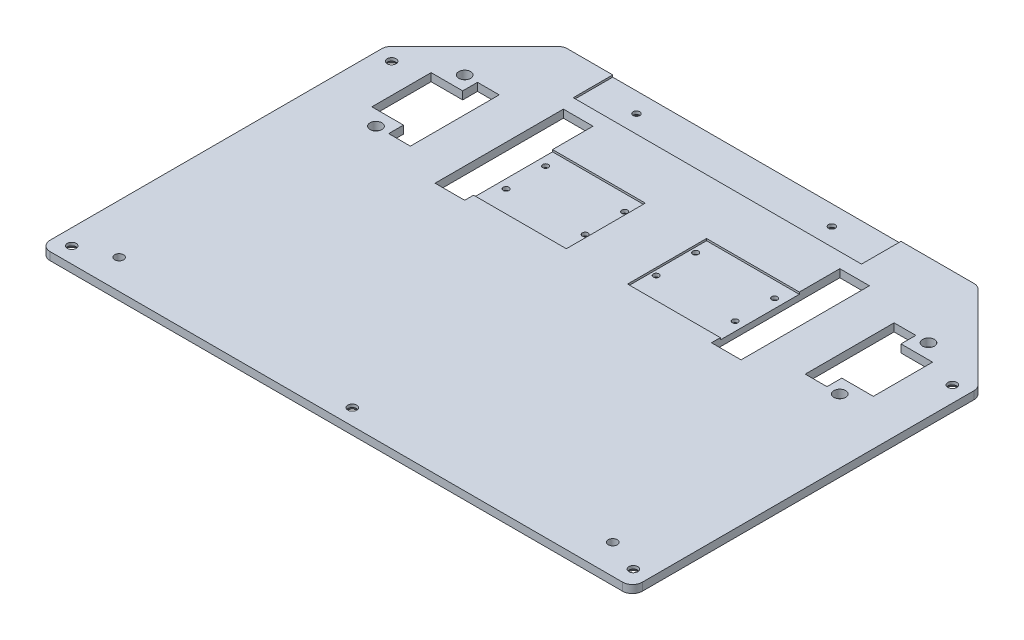
from build123d import *

# Parameters (mm, degrees)
MAIN_EXTRUSION_DEPTH                             = 4
CORNER_LEAVE_R                                   = 5
ESQUISSE2_R                                      = 3
ESQUISSE2_W                                      = 15
ESQUISSE2_H                                      = 65
ENL_V_MAT_EXTRU_1_DEPTH                          = 267.30058205
D_GAGEMENT_M41_D                                 = 4.5
ESQUISSE23_W                                     = 47
ESQUISSE23_H                                     = 40
ENL_V_MAT_EXTRU_2_DEPTH                          = 1
ESQUISSE24_R                                     = 1
ENL_V_MAT_EXTRU_3_DEPTH                          = 267.287438682
FRAISAGE_POUR_VIS_T_TE_FRAIS_E_M2_51_D           = 2.9
FRAISAGE_POUR_VIS_T_TE_FRAIS_E_M2_51_CSINK_D     = 5.5
FRAISAGE_POUR_VIS_T_TE_FRAIS_E_M2_51_CSINK_ANGLE = 90
FRAISAGE_POUR_VIS_T_TE_FRAIS_E_M41_AT_COUNT      = 2
FRAISAGE_POUR_VIS_T_TE_FRAIS_E_M41_AT_PITCH      = 142.035307944
FRAISAGE_POUR_VIS_T_TE_FRAIS_E_M41_2_COUNT       = 2
FRAISAGE_POUR_VIS_T_TE_FRAIS_E_M41_2_PITCH       = 284.035249862
FRAISAGE_POUR_VIS_T_TE_FRAIS_E_M41_3_COUNT       = 2
FRAISAGE_POUR_VIS_T_TE_FRAIS_E_M41_3_PITCH       = 326.770782266
FRAISAGE_POUR_VIS_T_TE_FRAIS_E_M41_4_COUNT       = 2
FRAISAGE_POUR_VIS_T_TE_FRAIS_E_M41_4_PITCH       = 161.565191978
ESQUISSE32_W                                     = 146
ESQUISSE32_H                                     = 20
ENL_V_MAT_EXTRU_4_DEPTH                          = 1
ESQUISSE33_R                                     = 1
ENL_V_MAT_EXTRU_5_DEPTH                          = 267.30058205
FRAISAGE_POUR_VIS_T_TE_FRAIS_E_M31_D             = 3.4
FRAISAGE_POUR_VIS_T_TE_FRAIS_E_M31_CSINK_D       = 6.3
FRAISAGE_POUR_VIS_T_TE_FRAIS_E_M31_CSINK_ANGLE   = 90


with BuildPart() as part:
    # Main scetch → Main extrusion (new body)
    with BuildSketch(Plane(origin=(0, 0, 0), x_dir=(1, 0, 0), z_dir=(0, 1, 0))):
        Polygon((-150, 0), (150, 0), (150, 175), (105, 220), (-105, 220), (-150, 175), align=None)
    extrude(amount=MAIN_EXTRUSION_DEPTH)

    # Corner leave
    corner_leave_edges = [part.edges().sort_by_distance(p)[0] for p in [
        (-150, 2, 0),
        (150, 2, -175),
        (105, 2, -220),
        (150, 2, 0),
        (-105, 2, -220),
        (-150, 2, -175),
    ]]
    fillet(corner_leave_edges, radius=CORNER_LEAVE_R)

    # Esquisse2 → Enlèv. mat.-Extru.1 (cut, through all)
    with BuildSketch(Plane(origin=(0, 4, 0), x_dir=(1, 0, 0), z_dir=(0, 1, 0))):
        with Locations((117.47, 182.47)):
            Circle(ESQUISSE2_R)
        with Locations((117.47, 137.53)):
            Circle(ESQUISSE2_R)
        with Locations((-117.47, 137.53)):
            Circle(ESQUISSE2_R)
        with Locations((-117.47, 182.47)):
            Circle(ESQUISSE2_R)
        with Locations((70, 160)):
            Rectangle(ESQUISSE2_W, ESQUISSE2_H)
        Polygon((100, 137.5), (100, 182.5), (111, 182.5), (111, 175), (127, 175), (127, 145), (111, 145), (111, 137.5), align=None)
        Polygon((-111, 137.5), (-111, 145), (-127, 145), (-127, 175), (-111, 175), (-111, 182.5), (-100, 182.5), (-100, 137.5), align=None)
        with Locations((-70, 160)):
            Rectangle(ESQUISSE2_W, ESQUISSE2_H)
    extrude(amount=-ENL_V_MAT_EXTRU_1_DEPTH, mode=Mode.SUBTRACT)

    # Dégagement M41 (through all)
    with Locations(Plane(origin=(0, 4, 0), x_dir=(1, 0, 0), z_dir=(0, 1, 0))):
        with Locations((-125, 15), (125, 15)):
            Hole(D_GAGEMENT_M41_D / 2)

    # Esquisse23 → Enlèv. mat.-Extru.2 (cut)
    with BuildSketch(Plane(origin=(0, 4, 0), x_dir=(1, 0, 0), z_dir=(0, 1, 0))):
        with Locations((-39, 152)):
            Rectangle(ESQUISSE23_W, ESQUISSE23_H)
    enl_v_mat_extru_2 = extrude(amount=-ENL_V_MAT_EXTRU_2_DEPTH, mode=Mode.SUBTRACT)

    # Esquisse24 → Enlèv. mat.-Extru.3 (cut, through all)
    with BuildSketch(Plane(origin=(0, 3, 0), x_dir=(1, 0, 0), z_dir=(0, 1, 0))):
        with Locations((-58, 164)):
            Circle(ESQUISSE24_R)
        with Locations((-58, 144)):
            Circle(ESQUISSE24_R)
        with Locations((-18, 164)):
            Circle(ESQUISSE24_R)
        with Locations((-18, 144)):
            Circle(ESQUISSE24_R)
    enl_v_mat_extru_3 = extrude(amount=-ENL_V_MAT_EXTRU_3_DEPTH, mode=Mode.SUBTRACT)

    # Fraisage pour vis à tête fraisée M2.51 (through all)
    with Locations(Plane(origin=(0, 0, 0), x_dir=(-1, 0, 0), z_dir=(0, -1, 0))):
        with Locations((18, 164), (58, 164), (58, 144), (18, 144)):
            fraisage_pour_vis_t_te_frais_e_m2_51 = CounterSinkHole(FRAISAGE_POUR_VIS_T_TE_FRAIS_E_M2_51_D / 2, FRAISAGE_POUR_VIS_T_TE_FRAIS_E_M2_51_CSINK_D / 2, counter_sink_angle=FRAISAGE_POUR_VIS_T_TE_FRAIS_E_M2_51_CSINK_ANGLE)

    # Symétrie1: Enlèv. mat.-Extru.2, Enlèv. mat.-Extru.3, Fraisage pour vis à tête fraisée M2.51 across plane
    add(enl_v_mat_extru_2.mirror(Plane(origin=(0, 0, 0), x_dir=(0, 0, 1), z_dir=(1, 0, 0))), mode=Mode.SUBTRACT)
    add(enl_v_mat_extru_3.mirror(Plane(origin=(0, 0, 0), x_dir=(0, 0, 1), z_dir=(1, 0, 0))), mode=Mode.SUBTRACT)
    add(fraisage_pour_vis_t_te_frais_e_m2_51.mirror(Plane(origin=(0, 0, 0), x_dir=(0, 0, 1), z_dir=(1, 0, 0))), mode=Mode.SUBTRACT)

    # Esquisse31 → Fraisage pour vis à tête fraisée M41 (revolve, cut)
    with BuildSketch(Plane(origin=(142.034917049, 0, -8.434811795), x_dir=(0, 0, -1), z_dir=(1, 0, 0))):
        Polygon((0, 0), (0, 4), (2.25, 4), (2.25, 2.45), (4.7, 0), align=None)
    fraisage_pour_vis_t_te_frais_e_m41 = revolve(axis=Axis((142.034917049, -6.35, -8.434811795), (0, 1, 0)), mode=Mode.SUBTRACT)

    # Fraisage pour vis à tête fraisée M41 at: Fraisage pour vis à tête fraisée M41 ×2
    with Locations(*[Vector(-0.9999972478981508, 0, 0.002346102326084912) * (i * FRAISAGE_POUR_VIS_T_TE_FRAIS_E_M41_AT_PITCH) for i in range(1, FRAISAGE_POUR_VIS_T_TE_FRAIS_E_M41_AT_COUNT)]):
        add(fraisage_pour_vis_t_te_frais_e_m41, mode=Mode.SUBTRACT)

    # Fraisage pour vis _ t_te frais_e M41 2: Fraisage pour vis à tête fraisée M41 ×2
    with Locations(*[Vector(-0.9999988282676796, 0, 0.0015308374400840067) * (i * FRAISAGE_POUR_VIS_T_TE_FRAIS_E_M41_2_PITCH) for i in range(1, FRAISAGE_POUR_VIS_T_TE_FRAIS_E_M41_2_COUNT)]):
        add(fraisage_pour_vis_t_te_frais_e_m41, mode=Mode.SUBTRACT)

    # Fraisage pour vis _ t_te frais_e M41 3: Fraisage pour vis à tête fraisée M41 ×2
    with Locations(*[Vector(-0.8692176059291576, 0, -0.4944297255857335) * (i * FRAISAGE_POUR_VIS_T_TE_FRAIS_E_M41_3_PITCH) for i in range(1, FRAISAGE_POUR_VIS_T_TE_FRAIS_E_M41_3_COUNT)]):
        add(fraisage_pour_vis_t_te_frais_e_m41, mode=Mode.SUBTRACT)

    # Fraisage pour vis _ t_te frais_e M41 4: Fraisage pour vis à tête fraisée M41 ×2
    with Locations(*[Vector(-0.00021611739763843655, 0, -0.999999976646635) * (i * FRAISAGE_POUR_VIS_T_TE_FRAIS_E_M41_4_PITCH) for i in range(1, FRAISAGE_POUR_VIS_T_TE_FRAIS_E_M41_4_COUNT)]):
        add(fraisage_pour_vis_t_te_frais_e_m41, mode=Mode.SUBTRACT)

    # Esquisse32 → Enlèv. mat.-Extru.4 (cut)
    with BuildSketch(Plane(origin=(0, 4, 0), x_dir=(1, 0, 0), z_dir=(0, 1, 0))):
        with Locations((-7, 210)):
            Rectangle(ESQUISSE32_W, ESQUISSE32_H)
    extrude(amount=-ENL_V_MAT_EXTRU_4_DEPTH, mode=Mode.SUBTRACT)

    # Esquisse33 → Enlèv. mat.-Extru.5 (cut, through all)
    with BuildSketch(Plane.XZ):
        with Locations((-58, -210)):
            Circle(ESQUISSE33_R)
        with Locations((41, -210)):
            Circle(ESQUISSE33_R)
    extrude(amount=-ENL_V_MAT_EXTRU_5_DEPTH, mode=Mode.SUBTRACT)

    # Fraisage pour vis à tête fraisée M31 (through all)
    with Locations(Plane(origin=(0, 0, 0), x_dir=(-1, 0, 0), z_dir=(0, -1, 0))):
        with Locations((58, 210), (-41, 210)):
            CounterSinkHole(FRAISAGE_POUR_VIS_T_TE_FRAIS_E_M31_D / 2, FRAISAGE_POUR_VIS_T_TE_FRAIS_E_M31_CSINK_D / 2, counter_sink_angle=FRAISAGE_POUR_VIS_T_TE_FRAIS_E_M31_CSINK_ANGLE)


solid = part.part
